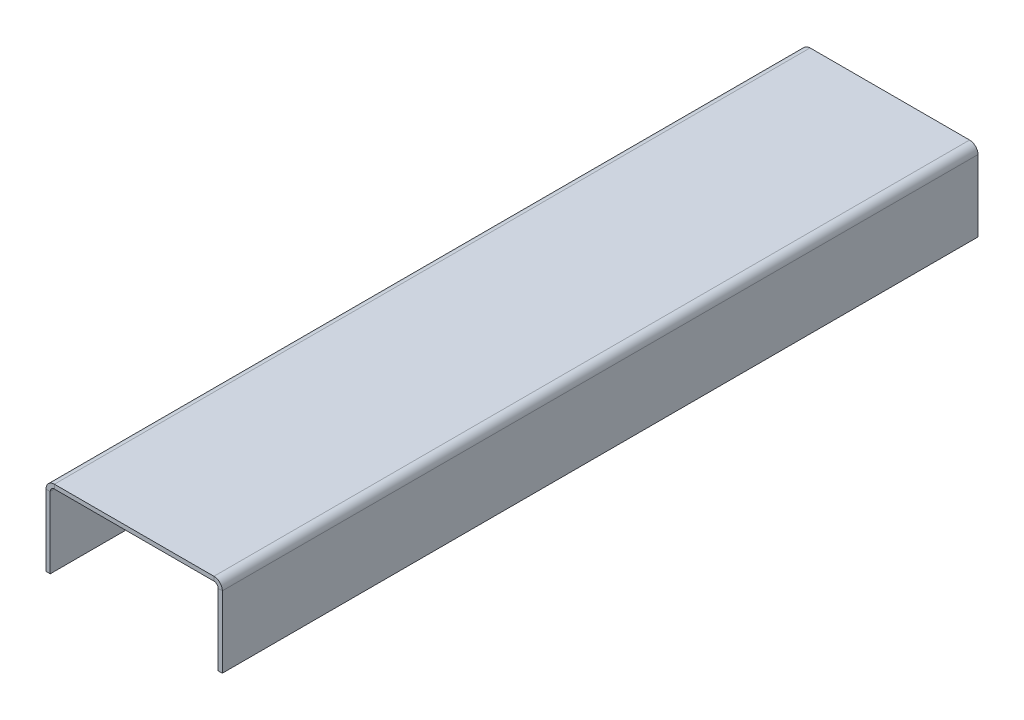
from build123d import *

# Parameters (mm, degrees)
SKETCH1_W                      = 80
SKETCH1_H                      = 360
BASE_FLANGE1_DEPTH             = 2
EDGE_FLANGE1_STRIP_W           = 12
EDGE_FLANGE1_STRIP_H           = 2
EDGE_FLANGE1_STRIP_CUT_DEPTH   = 360
EDGE_FLANGE1_STRIP_2_W         = 12
EDGE_FLANGE1_STRIP_2_H         = 2
EDGE_FLANGE1_STRIP_CUT_2_DEPTH = 360
EDGE_FLANGE1_DEPTH             = 360
EDGE_FLANGE1_BEND_DEPTH        = 360


# Sheet-metal steps are written as plain solids
with BuildPart() as part:
    # Sketch1 → Base-Flange1 (new body)
    with BuildSketch(Plane(origin=(0, 240, 0), x_dir=(1, 0, 0), z_dir=(0, 1, 0))):
        Rectangle(SKETCH1_W, SKETCH1_H)
    extrude(amount=BASE_FLANGE1_DEPTH)

    # Edge-Flange1 strip (across the edge) → Edge-Flange1 strip cut (cut)
    with BuildSketch(Plane(origin=(40, 240, -180), x_dir=(-1, 0, 0), z_dir=(0, 0, 1))):
        with Locations((-4, -1)):
            Rectangle(EDGE_FLANGE1_STRIP_W, EDGE_FLANGE1_STRIP_H)
    extrude(amount=EDGE_FLANGE1_STRIP_CUT_DEPTH, mode=Mode.SUBTRACT)

    # Edge-Flange1 strip 2 (across the edge) → Edge-Flange1 strip cut 2 (cut)
    with BuildSketch(Plane(origin=(-40, 240, 180), x_dir=(1, 0, 0), z_dir=(0, 0, -1))):
        with Locations((-4, -1)):
            Rectangle(EDGE_FLANGE1_STRIP_2_W, EDGE_FLANGE1_STRIP_2_H)
    extrude(amount=EDGE_FLANGE1_STRIP_CUT_2_DEPTH, mode=Mode.SUBTRACT)

    # Edge-Flange1 section (across the edge) → Edge-Flange1 (add)
    with BuildSketch(Plane(origin=(40, 240, -180), x_dir=(-1, 0, 0), z_dir=(0, 0, 1))):
        with BuildLine():
            Line((-2, 2), (-2, 36))
            Line((-2, 36), (0, 36))
            Line((0, 36), (0, 2))
            ThreePointArc((0, 2), (0.585786438, 0.585786438), (2, 0))
            Line((2, 0), (2, -2))
            ThreePointArc((2, -2), (-0.828427125, -0.828427125), (-2, 2))
        make_face()
    extrude(amount=EDGE_FLANGE1_DEPTH)

    # Edge-Flange1 section 2 (across the edge) → Edge-Flange1 bend (add)
    with BuildSketch(Plane(origin=(-40, 240, 180), x_dir=(1, 0, 0), z_dir=(0, 0, -1))):
        with BuildLine():
            Line((-2, 2), (-2, 36))
            Line((-2, 36), (0, 36))
            Line((0, 36), (0, 2))
            ThreePointArc((0, 2), (0.585786438, 0.585786438), (2, 0))
            Line((2, 0), (2, -2))
            ThreePointArc((2, -2), (-0.828427125, -0.828427125), (-2, 2))
        make_face()
    extrude(amount=EDGE_FLANGE1_BEND_DEPTH)


solid = part.part
